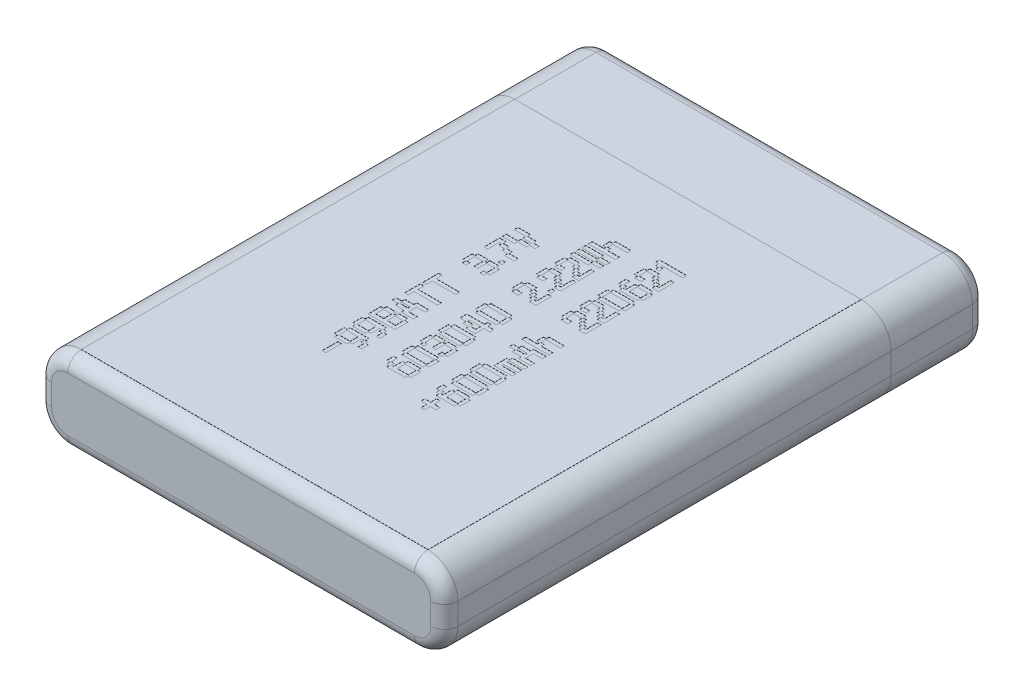
from build123d import *

# Parameters (mm, degrees)
SKETCH1_W                 = 30
SKETCH1_H                 = 40
BOSS_EXTRUDE1_DEPTH       = 6
FILLET1_R                 = 2.2
FILLET2_R                 = 1
BOSS_EXTRUDE8_OUTLINE_W   = 25.6
BOSS_EXTRUDE8_OUTLINE_H   = 32
BOSS_EXTRUDE8_OUTLINE_W_2 = 0.266104294
BOSS_EXTRUDE8_OUTLINE_H_2 = 1.157592025
BOSS_EXTRUDE8_OUTLINE_W_3 = 0.265720859
BOSS_EXTRUDE8_OUTLINE_H_3 = 0.290260736
BOSS_EXTRUDE8_OUTLINE_W_4 = 0.601226994
BOSS_EXTRUDE8_OUTLINE_H_4 = 0.143021473
BOSS_EXTRUDE8_OUTLINE_W_5 = 1.468174847
BOSS_EXTRUDE8_OUTLINE_H_5 = 0.576687116
BOSS_EXTRUDE8_OUTLINE_W_6 = 0.817868098
BOSS_EXTRUDE8_OUTLINE_H_6 = 0.576687117
BOSS_EXTRUDE8_OUTLINE_H_7 = 0.143021472
BOSS_EXTRUDE8_OUTLINE_W_7 = 1.468174846
BOSS_EXTRUDE8_DEPTH       = 0.01


# Read off the part's stored shape, not the designer's step: Boss-Extrude8
with BuildPart() as part:
    # Sketch1 → Boss-Extrude1 (new body)
    with BuildSketch(Plane(origin=(0, 0, 0), x_dir=(1, 0, 0), z_dir=(0, 1, 0))):
        Rectangle(SKETCH1_W, SKETCH1_H)
    extrude(amount=BOSS_EXTRUDE1_DEPTH)

    # Fillet1
    fillet1_edges = [part.edges().sort_by_distance(p)[0] for p in [
        (-15, 6, 0),
        (15, 6, 0),
        (-15, 6, 0),
        (-15, 0, 0),
        (15, 0, 0),
        (15, 6, 0),
        (-15, 0, 0),
        (15, 0, 0),
    ]]
    fillet(fillet1_edges, radius=FILLET1_R)

    # Fillet2
    fillet2_edges = [part.edges().sort_by_distance(p)[0] for p in [
        (-15, 3, -20),
        (0, 0, -20),
        (0, 6, -20),
        (15, 3, -20),
        (14.355634919, 5.355634919, -20),
        (14.355634919, 0.644365081, -20),
        (-14.355634919, 5.355634919, -20),
        (-14.355634919, 0.644365081, -20),
        (-15, 3, 20),
        (0, 0, 20),
        (15, 3, 20),
        (0, 6, 20),
        (14.355634919, 5.355634919, 20),
        (14.355634919, 0.644365081, 20),
        (-14.355634919, 5.355634919, 20),
        (-14.355634919, 0.644365081, 20),
    ]]
    fillet(fillet2_edges, radius=FILLET2_R)

    # Boss-Extrude8 outline → Boss-Extrude8 (add)
    # profile 1 of 17: a face of its own
    with BuildSketch(Plane(origin=(0, 6, 0), x_dir=(1, 0, 0), z_dir=(0, 1, 0))):
        with Locations((0, -3)):
            Rectangle(BOSS_EXTRUDE8_OUTLINE_W, BOSS_EXTRUDE8_OUTLINE_H)
        with Locations((-3.697990863, -9.617312907)):
            Rectangle(BOSS_EXTRUDE8_OUTLINE_W_2, BOSS_EXTRUDE8_OUTLINE_H_2, mode=Mode.SUBTRACT)
        Polygon((-4.481349759, -7.905848182), (-4.264325219, -7.905848182), (-4.264325219, -7.688823643), (-2.914631967, -7.688823643), (-2.914631967, -7.905848182), (-2.697990863, -7.905848182), (-2.697990863, -8.122489287), (-2.481349759, -8.122489287), (-2.481349759, -8.629774563), (-2.747070618, -8.629774563), (-2.747070618, -8.196108919), (-2.963711722, -8.196108919), (-2.963711722, -7.979467814), (-3.131656507, -7.979467814), (-3.131656507, -8.629774563), (-3.348297612, -8.629774563), (-3.348297612, -8.846415667), (-4.264325219, -8.846415667), (-4.264325219, -8.629774563), (-4.481349759, -8.629774563), align=None, mode=Mode.SUBTRACT)
        Polygon((-4.481349759, -6.556154931), (-4.264325219, -6.556154931), (-4.264325219, -6.339130391), (-2.914631967, -6.339130391), (-2.914631967, -6.556154931), (-2.697990863, -6.556154931), (-2.697990863, -6.772796035), (-2.481349759, -6.772796035), (-2.481349759, -7.280081311), (-2.747070618, -7.280081311), (-2.747070618, -6.846415667), (-2.963711722, -6.846415667), (-2.963711722, -6.629774563), (-3.131656507, -6.629774563), (-3.131656507, -7.280081311), (-3.348297612, -7.280081311), (-3.348297612, -7.496722416), (-4.264325219, -7.496722416), (-4.264325219, -7.280081311), (-4.481349759, -7.280081311), align=None, mode=Mode.SUBTRACT)
        Polygon((-4.264325219, -4.989437139), (-3.564938716, -4.989437139), (-3.564938716, -5.206461679), (-3.397377366, -5.206461679), (-3.397377366, -4.989437139), (-2.697990863, -4.989437139), (-2.697990863, -5.206461679), (-2.481349759, -5.206461679), (-2.481349759, -6.147029164), (-4.481349759, -6.147029164), (-4.481349759, -5.206461679), (-4.264325219, -5.206461679), align=None, mode=Mode.SUBTRACT)
        Polygon((-4.047684115, -4.363670268), (-4.481349759, -4.363670268), (-4.481349759, -4.073409532), (-4.047684115, -4.073409532), (-4.047684115, -3.856768428), (-3.397377366, -3.856768428), (-3.397377366, -3.639743888), (-2.481349759, -3.639743888), (-2.481349759, -3.93038806), (-3.131656507, -3.93038806), (-3.131656507, -4.507075176), (-2.481349759, -4.507075176), (-2.481349759, -4.797335912), (-3.397377366, -4.797335912), (-3.397377366, -4.580694808), (-4.047684115, -4.580694808), align=None, mode=Mode.SUBTRACT)
        Polygon((-0.61401847, -8.412750023), (-0.83104301, -8.412750023), (-0.83104301, -7.905848182), (-0.564938716, -7.905848182), (-0.564938716, -8.339130391), (-0.348297612, -8.339130391), (-0.348297612, -8.556154931), (-0.180736262, -8.556154931), (-0.180736262, -7.905848182), (0.036288278, -7.905848182), (0.036288278, -7.688823643), (0.952315885, -7.688823643), (0.952315885, -7.905848182), (1.16895699, -7.905848182), (1.16895699, -8.629774563), (0.952315885, -8.629774563), (0.952315885, -8.846415667), (-0.397377366, -8.846415667), (-0.397377366, -8.629774563), (-0.61401847, -8.629774563), align=None, mode=Mode.SUBTRACT)
        Polygon((3.469570487, -9.762443274), (3.036288278, -9.762443274), (3.036288278, -9.472182538), (3.469570487, -9.472182538), (3.469570487, -9.038516894), (3.735674781, -9.038516894), (3.735674781, -9.472182538), (4.16895699, -9.472182538), (4.16895699, -9.762443274), (3.735674781, -9.762443274), (3.735674781, -10.196108919), (3.469570487, -10.196108919), align=None, mode=Mode.SUBTRACT)
        Polygon((4.602622634, -7.905848182), (4.819263738, -7.905848182), (4.819263738, -8.629774563), (4.602622634, -8.629774563), (4.602622634, -8.846415667), (3.252929382, -8.846415667), (3.252929382, -8.629774563), (3.036288278, -8.629774563), (3.036288278, -8.412750023), (2.819263738, -8.412750023), (2.819263738, -7.905848182), (3.085368033, -7.905848182), (3.085368033, -8.339130391), (3.302009137, -8.339130391), (3.302009137, -8.556154931), (3.469570487, -8.556154931), (3.469570487, -7.905848182), (3.686595026, -7.905848182), (3.686595026, -7.688823643), (4.602622634, -7.688823643), align=None, mode=Mode.SUBTRACT)
        Polygon((-0.61401847, -7.280081311), (-0.83104301, -7.280081311), (-0.83104301, -6.556154931), (-0.61401847, -6.556154931), (-0.61401847, -6.339130391), (0.952315885, -6.339130391), (0.952315885, -6.556154931), (1.16895699, -6.556154931), (1.16895699, -7.280081311), (0.952315885, -7.280081311), (0.952315885, -7.496722416), (-0.61401847, -7.496722416), align=None, mode=Mode.SUBTRACT)
        Polygon((-0.61401847, -5.93038806), (-0.83104301, -5.93038806), (-0.83104301, -5.206461679), (-0.61401847, -5.206461679), (-0.61401847, -4.989437139), (0.085368033, -4.989437139), (0.085368033, -5.206461679), (0.252929382, -5.206461679), (0.252929382, -4.989437139), (0.952315885, -4.989437139), (0.952315885, -5.206461679), (1.16895699, -5.206461679), (1.16895699, -5.93038806), (0.952315885, -5.93038806), (0.952315885, -6.147029164), (0.686595026, -6.147029164), (0.686595026, -5.856768428), (0.903236131, -5.856768428), (0.903236131, -5.280081311), (0.302009137, -5.280081311), (0.302009137, -5.93038806), (0.036288278, -5.93038806), (0.036288278, -5.280081311), (-0.564938716, -5.280081311), (-0.564938716, -5.856768428), (-0.348297612, -5.856768428), (-0.348297612, -6.147029164), (-0.61401847, -6.147029164), align=None, mode=Mode.SUBTRACT)
        Polygon((-0.61401847, -4.580694808), (-0.83104301, -4.580694808), (-0.83104301, -3.856768428), (-0.61401847, -3.856768428), (-0.61401847, -3.639743888), (0.952315885, -3.639743888), (0.952315885, -3.856768428), (1.16895699, -3.856768428), (1.16895699, -4.580694808), (0.952315885, -4.580694808), (0.952315885, -4.797335912), (-0.61401847, -4.797335912), align=None, mode=Mode.SUBTRACT)
        Polygon((4.602622634, -6.556154931), (4.819263738, -6.556154931), (4.819263738, -7.280081311), (4.602622634, -7.280081311), (4.602622634, -7.496722416), (3.036288278, -7.496722416), (3.036288278, -7.280081311), (2.819263738, -7.280081311), (2.819263738, -6.556154931), (3.036288278, -6.556154931), (3.036288278, -6.339130391), (4.602622634, -6.339130391), align=None, mode=Mode.SUBTRACT)
        Polygon((4.602622634, -5.206461679), (4.819263738, -5.206461679), (4.819263738, -5.93038806), (4.602622634, -5.93038806), (4.602622634, -6.147029164), (3.036288278, -6.147029164), (3.036288278, -5.93038806), (2.819263738, -5.93038806), (2.819263738, -5.206461679), (3.036288278, -5.206461679), (3.036288278, -4.989437139), (4.602622634, -4.989437139), align=None, mode=Mode.SUBTRACT)
        Polygon((3.686595026, -3.639743888), (4.819263738, -3.639743888), (4.819263738, -3.93038806), (3.735674781, -3.93038806), (3.735674781, -4.073409532), (4.819263738, -4.073409532), (4.819263738, -4.363670268), (3.735674781, -4.363670268), (3.735674781, -4.507075176), (4.819263738, -4.507075176), (4.819263738, -4.797335912), (3.469570487, -4.797335912), (3.469570487, -3.856768428), (3.686595026, -3.856768428), align=None, mode=Mode.SUBTRACT)
        Polygon((-4.215245464, -3.447642661), (-4.481349759, -3.447642661), (-4.481349759, -2.290050636), (-4.215245464, -2.290050636), (-4.215245464, -2.723716281), (-2.481349759, -2.723716281), (-2.481349759, -3.013977017), (-4.215245464, -3.013977017), align=None, mode=Mode.SUBTRACT)
        Polygon((-4.215245464, -1.664283765), (-4.215245464, -2.097949409), (-4.481349759, -2.097949409), (-4.481349759, -0.940357385), (-4.215245464, -0.940357385), (-4.215245464, -1.374023029), (-2.481349759, -1.374023029), (-2.481349759, -1.664283765), align=None, mode=Mode.SUBTRACT)
        Polygon((-4.264325219, 1.759029118), (-3.564938716, 1.759029118), (-3.564938716, 1.542004578), (-3.397377366, 1.542004578), (-3.397377366, 1.759029118), (-2.697990863, 1.759029118), (-2.697990863, 1.542004578), (-2.481349759, 1.542004578), (-2.481349759, 0.818078198), (-2.697990863, 0.818078198), (-2.697990863, 0.601437094), (-2.963711722, 0.601437094), (-2.963711722, 0.89169783), (-2.747070618, 0.89169783), (-2.747070618, 1.468384946), (-3.348297612, 1.468384946), (-3.348297612, 0.818078198), (-3.61401847, 0.818078198), (-3.61401847, 1.468384946), (-4.215245464, 1.468384946), (-4.215245464, 0.89169783), (-3.99860436, 0.89169783), (-3.99860436, 0.601437094), (-4.264325219, 0.601437094), (-4.264325219, 0.818078198), (-4.481349759, 0.818078198), (-4.481349759, 1.542004578), (-4.264325219, 1.542004578), align=None, mode=Mode.SUBTRACT)
        Polygon((-3.99860436, 3.357955499), (-3.564938716, 3.357955499), (-3.564938716, 3.141314394), (-3.131656507, 3.141314394), (-3.131656507, 2.92467329), (-2.481349759, 2.92467329), (-2.481349759, 2.634029118), (-3.180736262, 2.634029118), (-3.180736262, 2.851053658), (-3.61401847, 2.851053658), (-3.61401847, 3.067694762), (-4.047684115, 3.067694762), (-4.047684115, 3.284335867), (-4.215245464, 3.284335867), (-4.215245464, 2.417388014), (-4.481349759, 2.417388014), (-4.481349759, 3.574980038), (-3.99860436, 3.574980038), align=None, mode=Mode.SUBTRACT)
        Polygon((-2.914631967, 3.98372237), (-3.564938716, 3.98372237), (-3.564938716, 3.767081265), (-4.481349759, 3.767081265), (-4.481349759, 4.057342002), (-3.61401847, 4.057342002), (-3.61401847, 4.274366542), (-2.963711722, 4.274366542), (-2.963711722, 4.417388014), (-3.61401847, 4.417388014), (-3.61401847, 4.634029118), (-4.481349759, 4.634029118), (-4.481349759, 4.92467329), (-3.564938716, 4.92467329), (-3.564938716, 4.70764875), (-2.914631967, 4.70764875), (-2.914631967, 4.491007646), (-2.481349759, 4.491007646), (-2.481349759, 4.20074691), (-2.914631967, 4.20074691), align=None, mode=Mode.SUBTRACT)
        with Locations((-2.830851293, 2.096260713)):
            Rectangle(BOSS_EXTRUDE8_OUTLINE_W_3, BOSS_EXTRUDE8_OUTLINE_H_3, mode=Mode.SUBTRACT)
        Polygon((-0.397377366, -3.013977017), (-0.83104301, -3.013977017), (-0.83104301, -2.507075176), (0.469570487, -2.507075176), (0.469570487, -2.290050636), (0.735674781, -2.290050636), (0.735674781, -2.507075176), (1.16895699, -2.507075176), (1.16895699, -2.797335912), (0.735674781, -2.797335912), (0.735674781, -3.447642661), (0.036288278, -3.447642661), (0.036288278, -3.231001557), (-0.397377366, -3.231001557), align=None, mode=Mode.SUBTRACT)
        Polygon((0.952315885, -1.881308305), (0.952315885, -2.097949409), (-0.61401847, -2.097949409), (-0.61401847, -1.881308305), (-0.83104301, -1.881308305), (-0.83104301, -1.157381925), (-0.61401847, -1.157381925), (-0.61401847, -0.940357385), (0.952315885, -0.940357385), (0.952315885, -1.157381925), (1.16895699, -1.157381925), (1.16895699, -1.881308305), align=None, mode=Mode.SUBTRACT)
        Polygon((4.16895699, -3.157381925), (4.819263738, -3.157381925), (4.819263738, -3.447642661), (3.903236131, -3.447642661), (3.903236131, -3.231001557), (3.252929382, -3.231001557), (3.252929382, -3.013977017), (2.819263738, -3.013977017), (2.819263738, -2.723716281), (3.252929382, -2.723716281), (3.252929382, -2.507075176), (3.903236131, -2.507075176), (3.903236131, -2.290050636), (4.819263738, -2.290050636), (4.819263738, -2.580694808), (4.16895699, -2.580694808), align=None, mode=Mode.SUBTRACT)
        Polygon((3.952315885, -1.807688673), (4.819263738, -1.807688673), (4.819263738, -2.097949409), (2.819263738, -2.097949409), (2.819263738, -1.807688673), (3.686595026, -1.807688673), (3.686595026, -1.664283765), (3.469570487, -1.664283765), (3.469570487, -1.157381925), (3.686595026, -1.157381925), (3.686595026, -0.940357385), (4.819263738, -0.940357385), (4.819263738, -1.231001557), (3.735674781, -1.231001557), (3.735674781, -1.590664133), (3.952315885, -1.590664133), align=None, mode=Mode.SUBTRACT)
        Polygon((-0.61401847, 0.818078198), (-0.83104301, 0.818078198), (-0.83104301, 1.542004578), (-0.61401847, 1.542004578), (-0.61401847, 1.759029118), (0.085368033, 1.759029118), (0.085368033, 1.542004578), (0.302009137, 1.542004578), (0.302009137, 1.325363474), (0.518650241, 1.325363474), (0.518650241, 1.10872237), (0.735674781, 1.10872237), (0.735674781, 0.89169783), (0.903236131, 0.89169783), (0.903236131, 1.759029118), (1.16895699, 1.759029118), (1.16895699, 0.601437094), (0.686595026, 0.601437094), (0.686595026, 0.818078198), (0.469570487, 0.818078198), (0.469570487, 1.035102738), (0.252929382, 1.035102738), (0.252929382, 1.251743842), (0.036288278, 1.251743842), (0.036288278, 1.468384946), (-0.564938716, 1.468384946), (-0.564938716, 0.89169783), (-0.131656507, 0.89169783), (-0.131656507, 0.601437094), (-0.61401847, 0.601437094), align=None, mode=Mode.SUBTRACT)
        Polygon((-0.61401847, 2.634029118), (-0.83104301, 2.634029118), (-0.83104301, 3.357955499), (-0.61401847, 3.357955499), (-0.61401847, 3.574980038), (0.085368033, 3.574980038), (0.085368033, 3.357955499), (0.302009137, 3.357955499), (0.302009137, 3.141314394), (0.518650241, 3.141314394), (0.518650241, 2.92467329), (0.735674781, 2.92467329), (0.735674781, 2.70764875), (0.903236131, 2.70764875), (0.903236131, 3.574980038), (1.16895699, 3.574980038), (1.16895699, 2.417388014), (0.686595026, 2.417388014), (0.686595026, 2.634029118), (0.469570487, 2.634029118), (0.469570487, 2.851053658), (0.252929382, 2.851053658), (0.252929382, 3.067694762), (0.036288278, 3.067694762), (0.036288278, 3.284335867), (-0.564938716, 3.284335867), (-0.564938716, 2.70764875), (-0.131656507, 2.70764875), (-0.131656507, 2.417388014), (-0.61401847, 2.417388014), align=None, mode=Mode.SUBTRACT)
        with Locations((0.819455455, 2.096260713)):
            Rectangle(BOSS_EXTRUDE8_OUTLINE_W_3, BOSS_EXTRUDE8_OUTLINE_H_3, mode=Mode.SUBTRACT)
        Polygon((-0.61401847, 3.98372237), (-0.83104301, 3.98372237), (-0.83104301, 4.70764875), (-0.61401847, 4.70764875), (-0.61401847, 4.92467329), (0.085368033, 4.92467329), (0.085368033, 4.70764875), (0.302009137, 4.70764875), (0.302009137, 4.491007646), (0.518650241, 4.491007646), (0.518650241, 4.274366542), (0.735674781, 4.274366542), (0.735674781, 4.057342002), (0.903236131, 4.057342002), (0.903236131, 4.92467329), (1.16895699, 4.92467329), (1.16895699, 3.767081265), (0.686595026, 3.767081265), (0.686595026, 3.98372237), (0.469570487, 3.98372237), (0.469570487, 4.20074691), (0.252929382, 4.20074691), (0.252929382, 4.417388014), (0.036288278, 4.417388014), (0.036288278, 4.634029118), (-0.564938716, 4.634029118), (-0.564938716, 4.057342002), (-0.131656507, 4.057342002), (-0.131656507, 3.767081265), (-0.61401847, 3.767081265), align=None, mode=Mode.SUBTRACT)
        Polygon((4.553542879, 1.759029118), (4.819263738, 1.759029118), (4.819263738, 0.601437094), (4.336901775, 0.601437094), (4.336901775, 0.818078198), (4.119877235, 0.818078198), (4.119877235, 1.035102738), (3.903236131, 1.035102738), (3.903236131, 1.251743842), (3.686595026, 1.251743842), (3.686595026, 1.468384946), (3.085368033, 1.468384946), (3.085368033, 0.89169783), (3.518650241, 0.89169783), (3.518650241, 0.601437094), (3.036288278, 0.601437094), (3.036288278, 0.818078198), (2.819263738, 0.818078198), (2.819263738, 1.542004578), (3.036288278, 1.542004578), (3.036288278, 1.759029118), (3.735674781, 1.759029118), (3.735674781, 1.542004578), (3.952315885, 1.542004578), (3.952315885, 1.325363474), (4.16895699, 1.325363474), (4.16895699, 1.10872237), (4.38598153, 1.10872237), (4.38598153, 0.89169783), (4.553542879, 0.89169783), align=None, mode=Mode.SUBTRACT)
        Polygon((4.553542879, 3.10872237), (4.819263738, 3.10872237), (4.819263738, 1.951130345), (4.336901775, 1.951130345), (4.336901775, 2.167771449), (4.119877235, 2.167771449), (4.119877235, 2.384795989), (3.903236131, 2.384795989), (3.903236131, 2.601437094), (3.686595026, 2.601437094), (3.686595026, 2.818078198), (3.085368033, 2.818078198), (3.085368033, 2.241391081), (3.518650241, 2.241391081), (3.518650241, 1.951130345), (3.036288278, 1.951130345), (3.036288278, 2.167771449), (2.819263738, 2.167771449), (2.819263738, 2.89169783), (3.036288278, 2.89169783), (3.036288278, 3.10872237), (3.735674781, 3.10872237), (3.735674781, 2.89169783), (3.952315885, 2.89169783), (3.952315885, 2.675056726), (4.16895699, 2.675056726), (4.16895699, 2.458415621), (4.38598153, 2.458415621), (4.38598153, 2.241391081), (4.553542879, 2.241391081), align=None, mode=Mode.SUBTRACT)
        Polygon((4.602622634, 4.241391081), (4.819263738, 4.241391081), (4.819263738, 3.517464701), (4.602622634, 3.517464701), (4.602622634, 3.300823597), (3.036288278, 3.300823597), (3.036288278, 3.517464701), (2.819263738, 3.517464701), (2.819263738, 4.241391081), (3.036288278, 4.241391081), (3.036288278, 4.458415621), (4.602622634, 4.458415621), align=None, mode=Mode.SUBTRACT)
        Polygon((0.469570487, 5.550440161), (-0.83104301, 5.550440161), (-0.83104301, 5.840700897), (0.469570487, 5.840700897), (0.469570487, 5.98372237), (-0.83104301, 5.98372237), (-0.83104301, 6.274366542), (0.518650241, 6.274366542), (0.518650241, 6.057342002), (1.16895699, 6.057342002), (1.16895699, 5.767081265), (0.518650241, 5.767081265), (0.518650241, 5.624059793), (1.16895699, 5.624059793), (1.16895699, 5.333415621), (0.518650241, 5.333415621), (0.518650241, 5.116774517), (-0.83104301, 5.116774517), (-0.83104301, 5.407035253), (0.469570487, 5.407035253), align=None, mode=Mode.SUBTRACT)
        Polygon((-0.83104301, 6.466467769), (-0.83104301, 6.756728505), (0.036288278, 6.756728505), (0.036288278, 6.900133413), (-0.180736262, 6.900133413), (-0.180736262, 7.407035253), (0.036288278, 7.407035253), (0.036288278, 7.624059793), (1.16895699, 7.624059793), (1.16895699, 7.333415621), (0.085368033, 7.333415621), (0.085368033, 6.973753045), (0.302009137, 6.973753045), (0.302009137, 6.756728505), (1.16895699, 6.756728505), (1.16895699, 6.466467769), align=None, mode=Mode.SUBTRACT)
        Polygon((4.602622634, 5.591084333), (4.819263738, 5.591084333), (4.819263738, 4.867157953), (4.602622634, 4.867157953), (4.602622634, 4.650516848), (3.252929382, 4.650516848), (3.252929382, 4.867157953), (3.036288278, 4.867157953), (3.036288278, 5.084182492), (2.819263738, 5.084182492), (2.819263738, 5.591084333), (3.085368033, 5.591084333), (3.085368033, 5.157802124), (3.302009137, 5.157802124), (3.302009137, 4.940777584), (3.469570487, 4.940777584), (3.469570487, 5.591084333), (3.686595026, 5.591084333), (3.686595026, 5.808108873), (4.602622634, 5.808108873), align=None, mode=Mode.SUBTRACT)
        Polygon((4.553542879, 7.157802124), (4.819263738, 7.157802124), (4.819263738, 6.0002101), (4.336901775, 6.0002101), (4.336901775, 6.216851204), (4.119877235, 6.216851204), (4.119877235, 6.433875744), (3.903236131, 6.433875744), (3.903236131, 6.650516848), (3.686595026, 6.650516848), (3.686595026, 6.867157953), (3.085368033, 6.867157953), (3.085368033, 6.290470836), (3.518650241, 6.290470836), (3.518650241, 6.0002101), (3.036288278, 6.0002101), (3.036288278, 6.216851204), (2.819263738, 6.216851204), (2.819263738, 6.940777584), (3.036288278, 6.940777584), (3.036288278, 7.157802124), (3.735674781, 7.157802124), (3.735674781, 6.940777584), (3.952315885, 6.940777584), (3.952315885, 6.72413648), (4.16895699, 6.72413648), (4.16895699, 6.507495376), (4.38598153, 6.507495376), (4.38598153, 6.290470836), (4.553542879, 6.290470836), align=None, mode=Mode.SUBTRACT)
        Polygon((4.819263738, 8.073829732), (4.819263738, 7.783568996), (3.302009137, 7.783568996), (3.302009137, 7.640164088), (3.518650241, 7.640164088), (3.518650241, 7.349903351), (3.252929382, 7.349903351), (3.252929382, 7.566544456), (3.036288278, 7.566544456), (3.036288278, 7.783568996), (2.819263738, 7.783568996), (2.819263738, 8.073829732), align=None, mode=Mode.SUBTRACT)
    # profile 2 of 17: a face of its own
    with BuildSketch(Plane(origin=(0, 6, 0), x_dir=(1, 0, 0), z_dir=(0, 1, 0))):
        with Locations((3.602622634, -2.868846648)):
            Rectangle(BOSS_EXTRUDE8_OUTLINE_W_4, BOSS_EXTRUDE8_OUTLINE_H_4)
    # profile 3 of 17: a face of its own
    with BuildSketch(Plane(origin=(0, 6, 0), x_dir=(1, 0, 0), z_dir=(0, 1, 0))):
        with Locations((0.169148708, -1.519345115)):
            Rectangle(BOSS_EXTRUDE8_OUTLINE_W_5, BOSS_EXTRUDE8_OUTLINE_H_5)
    # profile 4 of 17: a face of its own
    with BuildSketch(Plane(origin=(0, 6, 0), x_dir=(1, 0, 0), z_dir=(0, 1, 0))):
        with Locations((4.14460883, 5.229121143)):
            Rectangle(BOSS_EXTRUDE8_OUTLINE_W_6, BOSS_EXTRUDE8_OUTLINE_H_6)
    # profile 5 of 17: a face of its own
    with BuildSketch(Plane(origin=(0, 6, 0), x_dir=(1, 0, 0), z_dir=(0, 1, 0))):
        with Locations((4.14460883, -8.267811373)):
            Rectangle(BOSS_EXTRUDE8_OUTLINE_W_6, BOSS_EXTRUDE8_OUTLINE_H_6)
    # profile 6 of 17: a face of its own
    with BuildSketch(Plane(origin=(0, 6, 0), x_dir=(1, 0, 0), z_dir=(0, 1, 0))):
        Polygon((-0.348297612, -2.940357385), (0.085368033, -2.940357385), (0.085368033, -3.157381925), (0.469570487, -3.157381925), (0.469570487, -2.797335912), (-0.348297612, -2.797335912), align=None)
    # profile 7 of 17: a face of its own
    with BuildSketch(Plane(origin=(0, 6, 0), x_dir=(1, 0, 0), z_dir=(0, 1, 0))):
        with Locations((0.494302082, -8.267811373)):
            Rectangle(BOSS_EXTRUDE8_OUTLINE_W_6, BOSS_EXTRUDE8_OUTLINE_H_6)
    # profile 8 of 17: a face of its own
    with BuildSketch(Plane(origin=(0, 6, 0), x_dir=(1, 0, 0), z_dir=(0, 1, 0))):
        with Locations((-3.697990863, -4.2185399)):
            Rectangle(BOSS_EXTRUDE8_OUTLINE_W_4, BOSS_EXTRUDE8_OUTLINE_H_7)
    # profile 9 of 17: a face of its own
    with BuildSketch(Plane(origin=(0, 6, 0), x_dir=(1, 0, 0), z_dir=(0, 1, 0))):
        with Locations((-3.806311415, -6.918118121)):
            Rectangle(BOSS_EXTRUDE8_OUTLINE_W_6, BOSS_EXTRUDE8_OUTLINE_H_5)
    # profile 10 of 17: a face of its own
    with BuildSketch(Plane(origin=(0, 6, 0), x_dir=(1, 0, 0), z_dir=(0, 1, 0))):
        with Locations((-3.806311415, -8.267811373)):
            Rectangle(BOSS_EXTRUDE8_OUTLINE_W_6, BOSS_EXTRUDE8_OUTLINE_H_6)
    # profile 11 of 17: a face of its own
    with BuildSketch(Plane(origin=(0, 6, 0), x_dir=(1, 0, 0), z_dir=(0, 1, 0))):
        with Locations((-3.914631967, -5.56842487)):
            Rectangle(BOSS_EXTRUDE8_OUTLINE_W_4, BOSS_EXTRUDE8_OUTLINE_H_6)
    # profile 12 of 17: a face of its own
    with BuildSketch(Plane(origin=(0, 6, 0), x_dir=(1, 0, 0), z_dir=(0, 1, 0))):
        with Locations((3.819455456, 3.879427891)):
            Rectangle(BOSS_EXTRUDE8_OUTLINE_W_7, BOSS_EXTRUDE8_OUTLINE_H_5)
    # profile 13 of 17: a face of its own
    with BuildSketch(Plane(origin=(0, 6, 0), x_dir=(1, 0, 0), z_dir=(0, 1, 0))):
        with Locations((3.819455456, -5.56842487)):
            Rectangle(BOSS_EXTRUDE8_OUTLINE_W_7, BOSS_EXTRUDE8_OUTLINE_H_6)
    # profile 14 of 17: a face of its own
    with BuildSketch(Plane(origin=(0, 6, 0), x_dir=(1, 0, 0), z_dir=(0, 1, 0))):
        with Locations((3.819455456, -6.918118121)):
            Rectangle(BOSS_EXTRUDE8_OUTLINE_W_7, BOSS_EXTRUDE8_OUTLINE_H_5)
    # profile 15 of 17: a face of its own
    with BuildSketch(Plane(origin=(0, 6, 0), x_dir=(1, 0, 0), z_dir=(0, 1, 0))):
        with Locations((0.169148708, -4.218731618)):
            Rectangle(BOSS_EXTRUDE8_OUTLINE_W_5, BOSS_EXTRUDE8_OUTLINE_H_5)
    # profile 16 of 17: a face of its own
    with BuildSketch(Plane(origin=(0, 6, 0), x_dir=(1, 0, 0), z_dir=(0, 1, 0))):
        with Locations((0.169148708, -6.918118121)):
            Rectangle(BOSS_EXTRUDE8_OUTLINE_W_5, BOSS_EXTRUDE8_OUTLINE_H_5)
    # profile 17 of 17: a face of its own
    with BuildSketch(Plane(origin=(0, 6, 0), x_dir=(1, 0, 0), z_dir=(0, 1, 0))):
        with Locations((-3.047684115, -5.56842487)):
            Rectangle(BOSS_EXTRUDE8_OUTLINE_W_4, BOSS_EXTRUDE8_OUTLINE_H_6)
    extrude(amount=BOSS_EXTRUDE8_DEPTH)


solid = part.part
